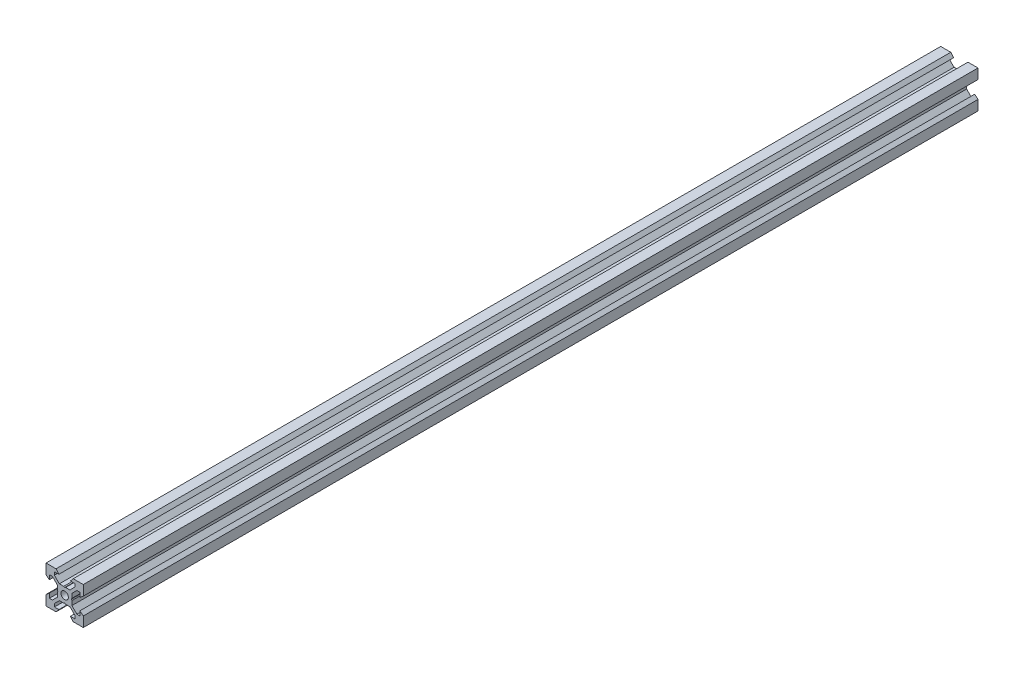
from build123d import *

# Parameters (mm, degrees)
SKETCH1_R           = 2
BOSS_EXTRUDE1_DEPTH = 240


with BuildPart() as part:
    # Sketch1 → Boss-Extrude1 (new, symmetric)
    with BuildSketch(Plane.XY):
        Polygon((10, 4.610379336), (10, 10), (4.610379336, 10), (3.1, 8.2), (5.5, 8.2), (5.5, 6.560660172), (2.839339828, 3.9), (0.519615242, 3.9), (0, 3.6), (-0.519615242, 3.9), (-2.839339828, 3.9), (-5.5, 6.560660172), (-5.5, 8.2), (-3.1, 8.2), (-4.610379336, 10), (-10, 10), (-10, 4.610379336), (-8.2, 3.1), (-8.2, 5.5), (-6.560660172, 5.5), (-3.9, 2.839339828), (-3.9, 0.519615242), (-3.6, 0), (-3.9, -0.519615242), (-3.9, -2.839339828), (-6.560660172, -5.5), (-8.2, -5.5), (-8.2, -3.1), (-10, -4.610379336), (-10, -10), (-4.610379336, -10), (-3.1, -8.2), (-5.5, -8.2), (-5.5, -6.560660172), (-2.839339828, -3.9), (-0.519615242, -3.9), (0, -3.6), (0.519615242, -3.9), (2.839339828, -3.9), (5.5, -6.560660172), (5.5, -8.2), (3.1, -8.2), (4.610379336, -10), (10, -10), (10, -4.610379336), (8.2, -3.1), (8.2, -5.5), (6.560660172, -5.5), (3.9, -2.839339828), (3.9, -0.519615242), (3.6, 0), (3.9, 0.519615242), (3.9, 2.839339828), (6.560660172, 5.5), (8.2, 5.5), (8.2, 3.1), align=None)
        Circle(SKETCH1_R, mode=Mode.SUBTRACT)
    extrude(amount=BOSS_EXTRUDE1_DEPTH, both=True)


solid = part.part
